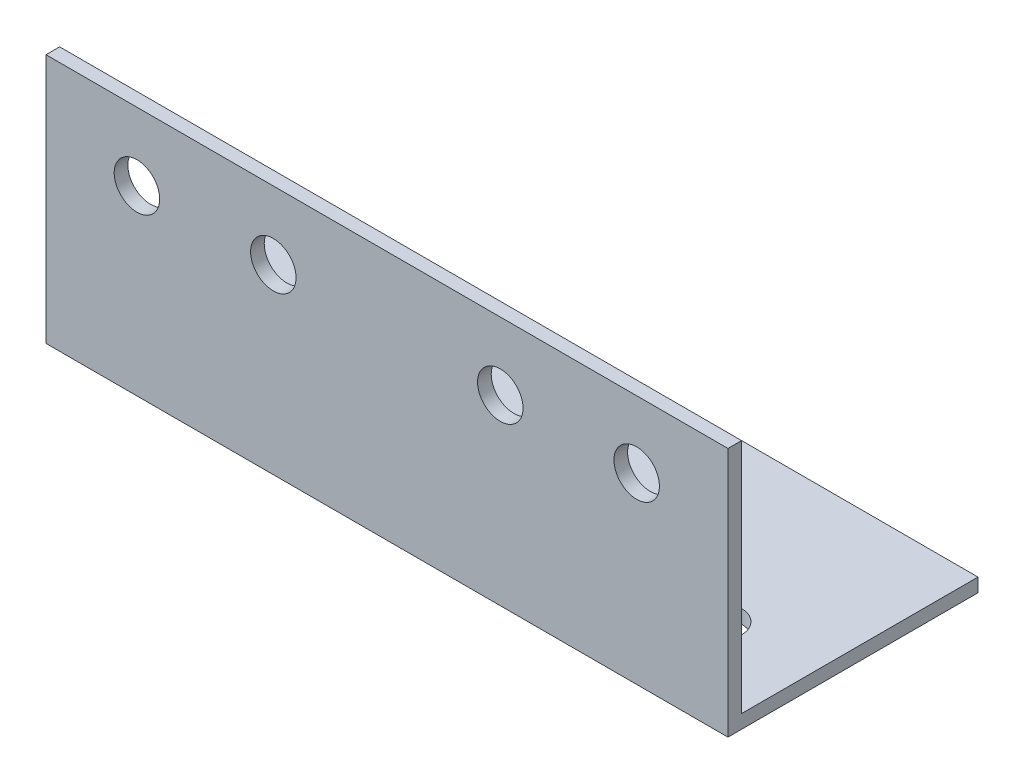
from build123d import *

# Parameters (mm, degrees)
EXTRUDE_1_DEPTH     = 150
SKETCH_2_R          = 5
CUT_EXTRUDE_1_DEPTH = 169.967452487
SKETCH_3_R          = 5
CUT_EXTRUDE_2_DEPTH = 169.967452487


with BuildPart() as part:
    # Эскиз1 → Вытянуть-Тонкостенный1 (new body)
    with BuildSketch(Plane(origin=(0, 0, 0), x_dir=(0, 0, -1), z_dir=(1, 0, 0))):
        Polygon((55, 0), (0, 0), (0, 55), (3, 55), (3, 3), (55, 3), align=None)
    extrude(amount=EXTRUDE_1_DEPTH)

    # Эскиз2 → Вырез-Вытянуть1 (cut, through all)
    with BuildSketch(Plane.XY):
        with Locations((20, 40)):
            Circle(SKETCH_2_R)
        with Locations((50, 40)):
            Circle(SKETCH_2_R)
        with Locations((99.928148489, 40.119107543)):
            Circle(SKETCH_2_R)
        with Locations((129.927807032, 40.262241468)):
            Circle(SKETCH_2_R)
    extrude(amount=-CUT_EXTRUDE_1_DEPTH, mode=Mode.SUBTRACT)

    # Эскиз3 → Вырез-Вытянуть2 (cut, through all)
    with BuildSketch(Plane.XZ):
        with Locations((130, -18)):
            Circle(SKETCH_3_R)
        with Locations((100, -18)):
            Circle(SKETCH_3_R)
        with Locations((50, -18)):
            Circle(SKETCH_3_R)
        with Locations((20, -18)):
            Circle(SKETCH_3_R)
    extrude(amount=-CUT_EXTRUDE_2_DEPTH, mode=Mode.SUBTRACT)


solid = part.part
